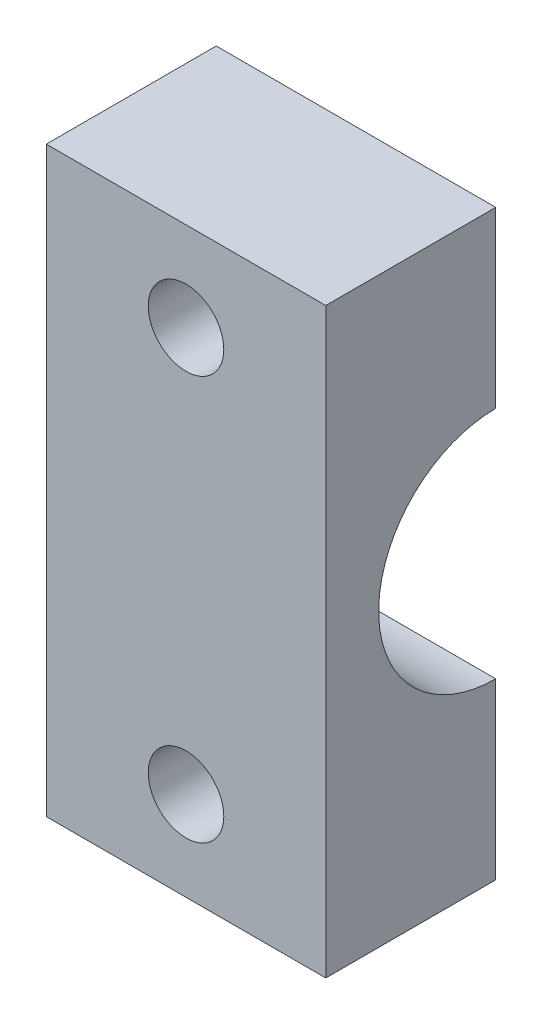
from build123d import *

# Parameters (mm, degrees)
SKETCH2_W               = 180
SKETCH2_H               = 9
BOSS_EXTRUDE1_DEPTH     = 14.8
SKETCH7_W               = 90
SKETCH7_H               = 4.5
CUT_EXTRUDE1_DEPTH      = 92.319713096
FILLET1_R               = 8
BOSS_EXTRUDE2_DEPTH     = 14.8
CUT_EXTRUDE2_DEPTH      = 175.130679781
CUT_EXTRUDE2_DEPTH_BACK = 175.130679781
SKETCH11_R              = 2
CUT_EXTRUDE3_DEPTH      = 107.467114171
CUT_EXTRUDE3_DEPTH_BACK = 107.467114171


with BuildPart() as part:
    # Sketch2 → Boss-Extrude1 (new body)
    with BuildSketch(Plane(origin=(0, 0, 0), x_dir=(0, 0, -1), z_dir=(1, 0, 0))):
        Rectangle(SKETCH2_W, SKETCH2_H)
    extrude(amount=BOSS_EXTRUDE1_DEPTH)

    # Sketch7 → Cut-Extrude1 (cut, through all)
    with BuildSketch(Plane(origin=(14.8, 0, 0), x_dir=(0, 0, -1), z_dir=(1, 0, 0))):
        with Locations((0, -2.25)):
            Rectangle(SKETCH7_W, SKETCH7_H)
    extrude(amount=-CUT_EXTRUDE1_DEPTH, mode=Mode.SUBTRACT)

    # Fillet1
    # the kernel refuses this fillet: 8 mm, written as the material it adds along each edge
    with BuildSketch(Plane(origin=(14.8, 0, -45), x_dir=(0, -1, 0), z_dir=(-1, 0, 0))) as fillet1_piece_1:
        with BuildLine():
            CenterArc((8, 7.193747285), FILLET1_R, 180, 64.055520228)
            Line((0, 7.193747285), (-0.16, 7.193747285))
            Line((-0.16, 7.193747285), (-0.16, 0))
            Line((-0.16, 0), (0, -0.16))
            ThreePointArc((0, -0.16), (2.25, -0.16), (4.43, -0.143874946))
            Line((4.43, -0.143874946), (4.5, 0))
        make_face()
    extrude(amount=14.8)
    with BuildSketch(Plane(origin=(14.8, 0, 45), x_dir=(0, -1, 0), z_dir=(-1, 0, 0))) as fillet1_piece_2:
        with BuildLine():
            CenterArc((8, -7.193747285), FILLET1_R, 115.944479772, 64.055520228)
            Line((0, -7.193747285), (-0.16, -7.193747285))
            Line((-0.16, -7.193747285), (-0.16, 0))
            Line((-0.16, 0), (0, 0.16))
            ThreePointArc((0, 0.16), (2.25, 0.16), (4.43, 0.143874946))
            Line((4.43, 0.143874946), (4.5, 0))
        make_face()
    extrude(amount=14.8)

    # Sketch8 → Boss-Extrude2 (add)
    with BuildSketch(Plane(origin=(14.8, 0, 0), x_dir=(0, 0, -1), z_dir=(1, 0, 0))):
        with BuildLine():
            Line((83.579, -39.5), (83.579, -54.92))
            Line((83.579, -54.92), (74.579, -54.92))
            Line((74.579, -54.92), (74.579, -45.7))
            ThreePointArc((74.579, -45.7), (80.779, -39.5), (74.579, -33.3))
            Line((74.579, -33.3), (74.579, -4.5))
            Line((74.579, -4.5), (83.579, -4.5))
            Line((83.579, -4.5), (83.579, -39.5))
        make_face()
        with BuildLine():
            Line((-74.579, -54.92), (-74.579, -45.7))
            ThreePointArc((-74.579, -45.7), (-80.779, -39.5), (-74.579, -33.3))
            Line((-74.579, -33.3), (-74.579, -4.5))
            Line((-74.579, -4.5), (-83.579, -4.5))
            Line((-83.579, -4.5), (-83.579, -39.5))
            Line((-83.579, -39.5), (-83.579, -54.92))
            Line((-83.579, -54.92), (-74.579, -54.92))
        make_face()
    extrude(amount=-BOSS_EXTRUDE2_DEPTH)

    # Sketch11 → Cut-Extrude2 (cut, two sides: drawn at the far end of the back side and taken through both)
    with BuildSketch(Plane(origin=(0, 0, 74.579), x_dir=(-1, 0, 0), z_dir=(0, 0, -1)).offset(-CUT_EXTRUDE2_DEPTH_BACK)):
        with Locations(Location((-7.4, -28.8, 0), (0, 0, 180))):
            Circle(SKETCH11_R)
        with Locations(Location((-7.4, -50.2, 0), (0, 0, 180))):
            Circle(SKETCH11_R)
    extrude(amount=CUT_EXTRUDE2_DEPTH + CUT_EXTRUDE2_DEPTH_BACK, mode=Mode.SUBTRACT)

    # Sketch12 → Cut-Extrude3 (cut, two sides: drawn at the far end of the back side and taken through both)
    with BuildSketch(Plane.ZY.offset(-CUT_EXTRUDE3_DEPTH_BACK)):
        Polygon((96.986162818, 8.741450318), (-95.153164269, 8.741450318), (-95.153164269, -16.038890922), (-95.153164269, -24.08), (-95.153164269, -55.626735024), (-68.956122855, -55.626735024), (-68.956122855, -24.08), (74.579, -24.08), (96.986162818, -24.08), (96.986162818, -16.038890922), (96.986162818, -4.5), align=None)
    extrude(amount=CUT_EXTRUDE3_DEPTH + CUT_EXTRUDE3_DEPTH_BACK, mode=Mode.SUBTRACT)


solid = part.part
